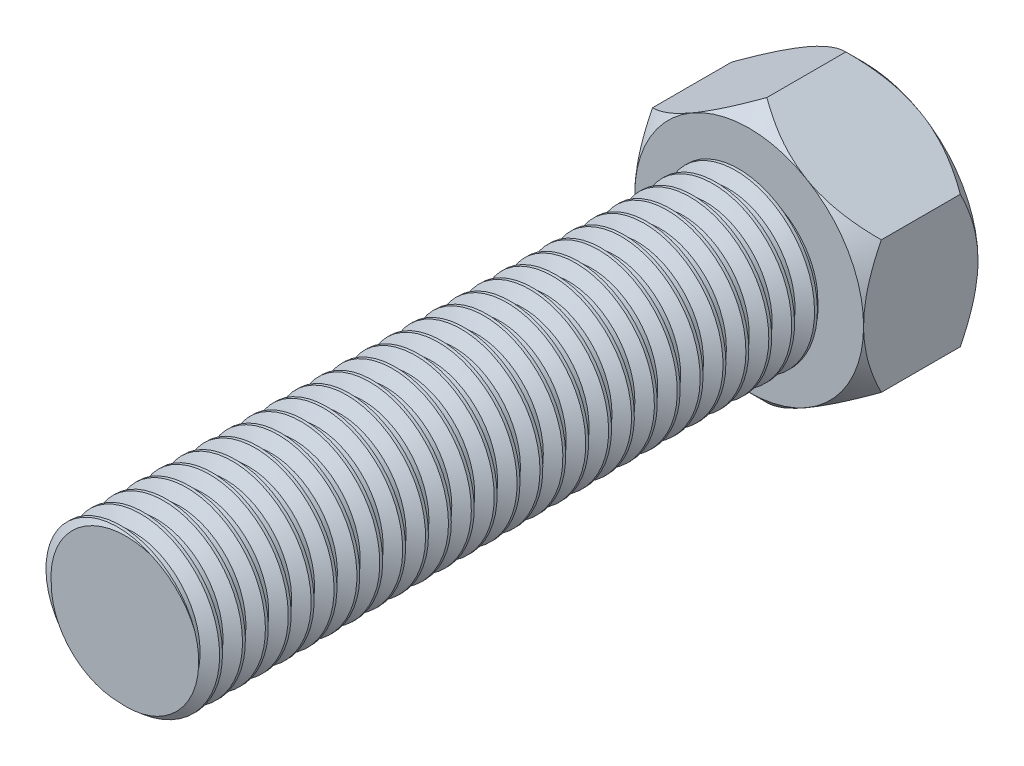
from build123d import *

# Parameters (mm, degrees)
SKETCH1_R               = 3
BOSS_EXTRUDE1_DEPTH     = 2.5
SKETCH2_R               = 3
BOSS_EXTRUDE2_DEPTH     = 27.5
SKETCH3_OUTSIDE_W       = 74.182
SKETCH3_OUTSIDE_H       = 75.73
SKETCH3_OUTSIDE_R       = 5
CUT_EXTRUDE1_DEPTH      = 27.5
CUT_EXTRUDE1_DRAFT      = -45
MIRROR1_COPY_1_SKETCH_W = 74.182
MIRROR1_COPY_1_SKETCH_H = 75.73
MIRROR1_COPY_1_SKETCH_R = 5
MIRROR1_COPY_1_DEPTH    = 27.5
MIRROR1_COPY_1_DRAFT    = -45
THREAD1_PITCH           = 1
THREAD1_FROM            = 1


with BuildPart() as part:
    # Sketch1 → Boss-Extrude1 (new, symmetric)
    # profile 1 of 2: a face of its own
    with BuildSketch(Plane.XY):
        Polygon((-5, 2.886751346), (-5, -2.886751346), (0, -5.773502692), (5, -2.886751346), (5, 2.886751346), (0, 5.773502692), align=None)
        Circle(SKETCH1_R, mode=Mode.SUBTRACT)
    # profile 2 of 2: a face of its own
    with BuildSketch(Plane.XY):
        Circle(SKETCH1_R)
    extrude(amount=BOSS_EXTRUDE1_DEPTH, both=True)

    # Sketch2 → Boss-Extrude2 (add)
    with BuildSketch(Plane.XY.offset(2.5)):
        Circle(SKETCH2_R)
    extrude(amount=BOSS_EXTRUDE2_DEPTH)


with BuildPart() as cut_extrude1_tool:
    # Sketch3 outside → Cut-Extrude1 (with draft: the straight prism first)
    with BuildSketch(Plane.XY.offset(2.5)):
        Rectangle(SKETCH3_OUTSIDE_W, SKETCH3_OUTSIDE_H)
        Circle(SKETCH3_OUTSIDE_R, mode=Mode.SUBTRACT)
    extrude(amount=-CUT_EXTRUDE1_DEPTH)
    # Cut-Extrude1: the draft: its side faces are tilted about the plane it starts from
    cut_extrude1_sides = [cut_extrude1_tool.faces().sort_by_distance(p)[0] for p in [
        (0, -37.865, -11.25),
        (37.091, 0, -11.25),
        (0, 37.865, -11.25),
        (-37.091, 0, -11.25),
        (-5, 0, -11.25),
    ]]
    draft(cut_extrude1_sides, Plane.XY.offset(2.5), CUT_EXTRUDE1_DRAFT)


with BuildPart() as part_1:
    add(part.part)

    # Cut-Extrude1: cut by cut_extrude1_tool
    add(cut_extrude1_tool.part, mode=Mode.SUBTRACT)


with BuildPart() as mirror1_copy_1_tool:
    # Mirror1 copy 1 sketch → Mirror1 copy 1 (with draft: the straight prism first)
    with BuildSketch(Plane(origin=(0, 0, -2.5), x_dir=(1, 0, 0), z_dir=(0, 0, -1))):
        Rectangle(MIRROR1_COPY_1_SKETCH_W, MIRROR1_COPY_1_SKETCH_H)
        Circle(MIRROR1_COPY_1_SKETCH_R, mode=Mode.SUBTRACT)
    extrude(amount=-MIRROR1_COPY_1_DEPTH)
    # Mirror1 copy 1: the draft: its side faces are tilted about the plane it starts from
    mirror1_copy_1_sides = [mirror1_copy_1_tool.faces().sort_by_distance(p)[0] for p in [
        (0, -37.865, 11.25),
        (37.091, 0, 11.25),
        (0, 37.865, 11.25),
        (-37.091, 0, 11.25),
        (-5, 0, 11.25),
    ]]
    draft(mirror1_copy_1_sides, Plane(origin=(0, 0, -2.5), x_dir=(1, 0, 0), z_dir=(0, 0, -1)), MIRROR1_COPY_1_DRAFT)


with BuildPart() as part_2:
    add(part_1.part)

    # Mirror1 copy 1: cut by mirror1_copy_1_tool
    add(mirror1_copy_1_tool.part, mode=Mode.SUBTRACT)

    # Thread1: arcs per turn and ends read off the stored shape
    # Thread1: the profile of Thread Profile1 profile screwed along a left-hand helix through 28.5 turns, 8 arcs to a turn; built about Z, then put on its axis
    thread1_z = Axis((0, 0, 0), (0, 0, 1))
    thread1_corners = [(2.9997, 0, -0.000173205), (3.541265875, 0, 0.312499999), (3.541265875, 0, 0.437499999), (2.9997, 0, 0.750173202)]
    with BuildLine(mode=Mode.PRIVATE) as thread1_profile:
        Line(thread1_corners[0], thread1_corners[1])
        Line(thread1_corners[1], thread1_corners[2])
        Line(thread1_corners[2], thread1_corners[3])
        Line(thread1_corners[3], thread1_corners[0])
    thread1_cap = Face(thread1_profile.wire())
    thread1_turn_angles = [0, -22.5, -45, -67.5, -90, -112.5, -135, -157.5, -180, -202.5, -225, -247.5, -270, -292.5, -315, -337.5, -360]
    thread1_turn_weights = [1, 0.9238795325112867, 1, 0.9238795325112867, 1, 0.9238795325112867, 1, 0.9238795325112867, 1, 0.9238795325112867, 1, 0.9238795325112867, 1, 0.9238795325112867, 1, 0.9238795325112867, 1]
    thread1_turn_rails = [Edge.make_bspline([Vector(p[0], p[1], 0).rotate(thread1_z, thread1_turn_angles[k]) / thread1_turn_weights[k] + Vector(0, 0, p[2] + -THREAD1_PITCH * thread1_turn_angles[k] / 360) for k in range(17)], [0, 0, 0, 1, 1, 2, 2, 3, 3, 4, 4, 5, 5, 6, 6, 7, 7, 8, 8, 8], 2, thread1_turn_weights) for p in thread1_corners]
    thread1_turn_sides = [Face.make_surface_from_curves(thread1_turn_rails[p[0]], thread1_turn_rails[p[1]]) for p in [(0, 1), (1, 2), (2, 3), (3, 0)]]
    thread1_last_angles = [-10080, -10102.5, -10125, -10147.5, -10170, -10192.5, -10215, -10237.5, -10260]
    thread1_last_weights = [1, 0.9238795325112867, 1, 0.9238795325112867, 1, 0.9238795325112867, 1, 0.9238795325112867, 1]
    thread1_last_rails = [Edge.make_bspline([Vector(p[0], p[1], 0).rotate(thread1_z, thread1_last_angles[k]) / thread1_last_weights[k] + Vector(0, 0, p[2] + -THREAD1_PITCH * thread1_last_angles[k] / 360) for k in range(9)], [0, 0, 0, 1, 1, 2, 2, 3, 3, 4, 4, 4], 2, thread1_last_weights) for p in thread1_corners]
    thread1_last_sides = [Face.make_surface_from_curves(thread1_last_rails[p[0]], thread1_last_rails[p[1]]) for p in [(0, 1), (1, 2), (2, 3), (3, 0)]]
    thread1 = Plane(origin=(0, 0, 31), x_dir=(-1, 0, 0), z_dir=(0, 0, -1)) * split(Solid(Shell([*[p.moved(Location((0, 0, THREAD1_PITCH * i))) for i in range(28) for p in thread1_turn_sides], *thread1_last_sides, thread1_cap, thread1_cap.rotate(thread1_z, -10260).moved(Location((0, 0, -THREAD1_PITCH * -10260 / 360)))])), bisect_by=Plane.XY.offset(THREAD1_FROM), keep=Keep.TOP, mode=Mode.PRIVATE)
    add(thread1)


solid = part_2.part
